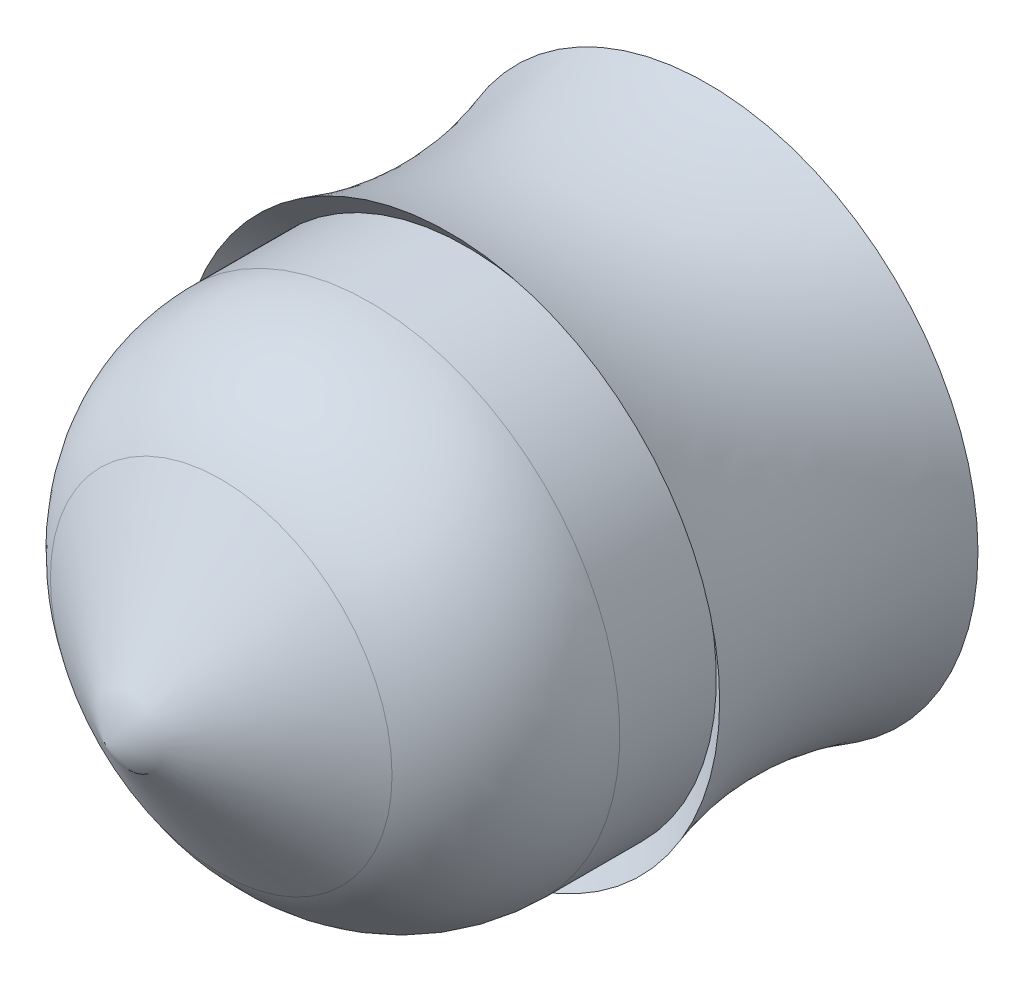
from build123d import *

# Parameters (mm, degrees)
SKICA1_R                 = 7.85
P_IDAT_VYSUNUT_M1_DEPTH  = 7.5
SKO_EPINA1_T             = -0.8
P_IDAT_VYSUNUT_M2_REACH  = 31.724
P_IDAT_START             = 9
SKICA6_R                 = 2
ODEBRAT_VYSUNUT_M1_REACH = 16.291
SKICA7_R                 = 1
P_IDAT_VYSUNUT_M7_REACH  = 31.724
KRUHOV_POLE1_COUNT       = 4


with BuildPart() as part:
    # Skica1 → Přidat vysunutím1 (new body)
    with BuildSketch(Plane.XY):
        Circle(SKICA1_R)
    extrude(amount=P_IDAT_VYSUNUT_M1_DEPTH)

    # Skica2 → Odebrat rotací1 (revolve, cut)
    with BuildSketch(Plane(origin=(0, 0, 0), x_dir=(1, 0, 0), z_dir=(0, 1, 0))):
        with BuildLine():
            Line((-7.85, -7.5), (-7.85, 0))
            ThreePointArc((-7.85, 0), (-7.249013115, -3.75), (-7.85, -7.5))
        make_face()
    revolve(axis=Axis((0, 0, 14.505867829), (0, 0, -1)), mode=Mode.SUBTRACT)

    # Skica4 → Rotovat1 (revolve)
    with BuildSketch(Plane(origin=(0, 0, 0), x_dir=(1, 0, 0), z_dir=(0, 1, 0))):
        with BuildLine():
            Line((0, -7.5), (-7.25, -7.5))
            Line((-7.25, -7.5), (-7.25, -9.8))
            ThreePointArc((-7.25, -9.8), (-6.642480949, -12.246842108), (-4.961030582, -14.125362899))
            Line((-4.961030582, -14.125362899), (0, -17.5))
            Line((0, -17.5), (0, -7.5))
        make_face()
    revolve(axis=Axis((0, 0, 0), (0, 0, 1)))

    # Skica5 → Odebrat rotací2 (revolve, cut)
    with BuildSketch(Plane(origin=(0, 0, 0), x_dir=(1, 0, 0), z_dir=(0, 1, 0))):
        Polygon((-7.25, -7.5), (-7.25, -6.996540221), (-7.85, -7.5), align=None)
    revolve(axis=Axis((0, 0, 0), (0, 0, 1)), mode=Mode.SUBTRACT)

    # Skořepina1
    sko_epina1_openings = [part.faces().sort_by_distance(p)[0] for p in [
        (0, 0, 0),
    ]]
    offset(amount=SKO_EPINA1_T, openings=sko_epina1_openings, kind=Kind.INTERSECTION)

    # Skica6 → Přidat vysunutím2 (add, up to next)
    with BuildSketch(Plane.XY.offset(P_IDAT_START), mode=Mode.PRIVATE) as p_idat_vysunut_m2_sk1:
        Circle(SKICA6_R)
    p_idat_vysunut_m2_tool1 = extrude(p_idat_vysunut_m2_sk1.sketch, amount=P_IDAT_VYSUNUT_M2_REACH, mode=Mode.PRIVATE) - part.part
    add(p_idat_vysunut_m2_tool1.solids().sort_by_distance((0, 0, 9))[0])

    # Odebrat vysunutím1: up to this cone (the profile starts inside it)
    odebrat_vysunut_m1_end = Plane(origin=(0, 0, 9), z_dir=(0, 0, -1)).offset(-7.532458099) * Cone(1.47e-06, 52.036700214, 35.396873947, align=(Align.CENTER, Align.CENTER, Align.MIN), mode=Mode.PRIVATE)
    # Skica7 → Odebrat vysunutím1 (cut, up to the surface)
    with BuildSketch(Plane(origin=(0, 0, 9), x_dir=(-1, 0, 0), z_dir=(0, 0, -1)), mode=Mode.PRIVATE) as odebrat_vysunut_m1_sk1:
        Circle(SKICA7_R)
    odebrat_vysunut_m1_tool1 = extrude(odebrat_vysunut_m1_sk1.sketch, amount=-ODEBRAT_VYSUNUT_M1_REACH, mode=Mode.PRIVATE) & odebrat_vysunut_m1_end
    add(odebrat_vysunut_m1_tool1.solids().sort_by_distance((0, 0, 9))[0], mode=Mode.SUBTRACT)

    # Skica8 → Přidat vysunutím7 (add, up to next)
    with BuildSketch(Plane.XY.offset(P_IDAT_START), mode=Mode.PRIVATE) as p_idat_vysunut_m7_sk1:
        with BuildLine():
            Line((1.959591794, 0.4), (6.437584951, 0.4))
            ThreePointArc((6.437584951, 0.4), (6.45, 0), (6.437584951, -0.4))
            Line((6.437584951, -0.4), (1.959591794, -0.4))
            ThreePointArc((1.959591794, -0.4), (1.999999985, 0), (1.959591794, 0.4))
        make_face()
    p_idat_vysunut_m7_tool1 = extrude(p_idat_vysunut_m7_sk1.sketch, amount=P_IDAT_VYSUNUT_M7_REACH, mode=Mode.PRIVATE) - part.part
    p_idat_vysunut_m7 = p_idat_vysunut_m7_tool1.solids().sort_by_distance((4.21621, 0, 9))[0]
    add(p_idat_vysunut_m7)

    # Kruhové pole1: Přidat vysunutím7 ×4 about axis
    kruhov_pole1_axis = Axis((0, 0, 9), (0, 0, -1))
    for i in range(1, KRUHOV_POLE1_COUNT):
        add(p_idat_vysunut_m7.rotate(kruhov_pole1_axis, i * 360 / KRUHOV_POLE1_COUNT))

    # Skica11 → Odebrat rotací4 (revolve, cut)
    with BuildSketch(Plane(origin=(0, 0, 0), x_dir=(1, 0, 0), z_dir=(0, 1, 0))):
        with BuildLine():
            Line((6.537584951, -9.8), (6.537584951, -9))
            Line((6.537584951, -9), (3.459591794, -9))
            Line((3.459591794, -9), (6.131876733, -11.672284939))
            add(Edge.make_bspline(
                [(6.131876733, -11.672284939), (6.246286925, -11.420538738), (6.459209516, -10.809321082), (6.537584951, -10.166218276), (6.537584951, -9.8)],
                knots=[0.562328638, 0.562328638, 0.562328638, 0.562328638, 0.749993301, 1, 1, 1, 1], degree=3))
        make_face()
    revolve(axis=Axis((0, 0, 0), (0, 0, 1)), mode=Mode.SUBTRACT)


solid = part.part
